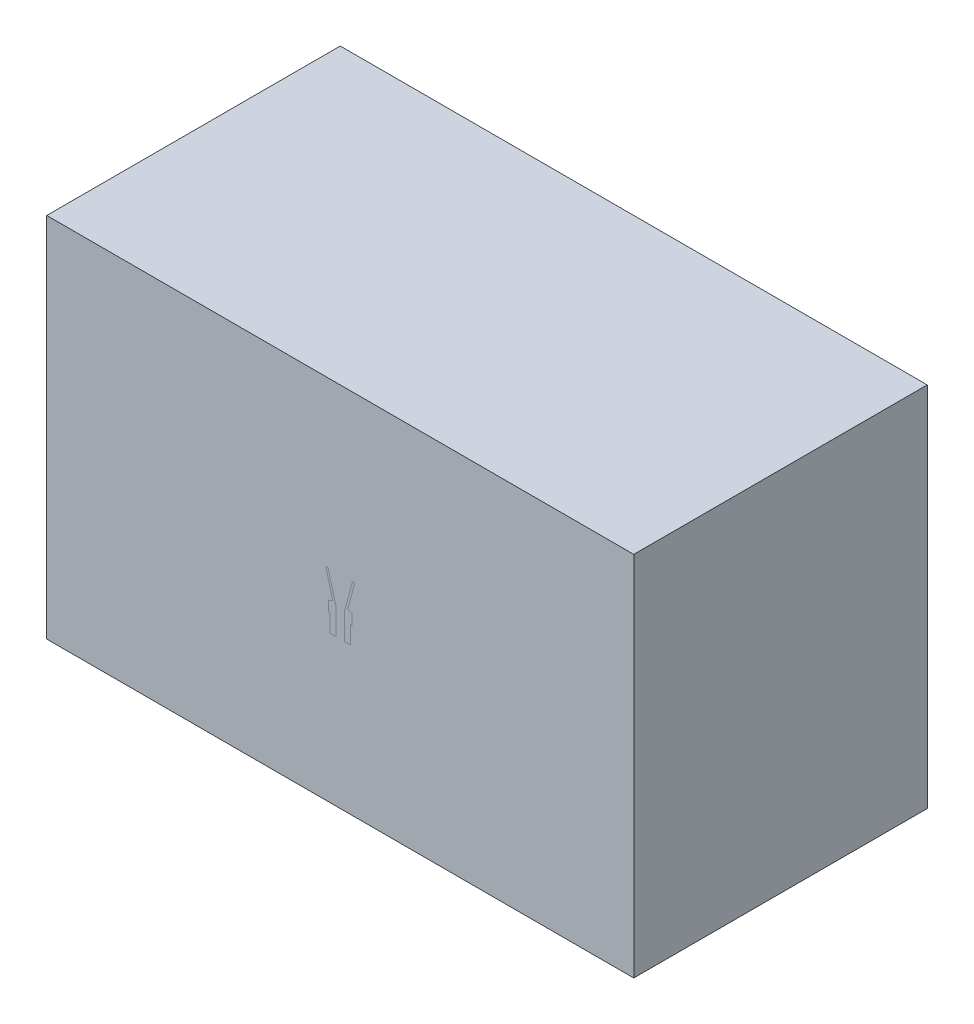
from build123d import *

# Parameters (mm, degrees)
SKETCH1_R           = 175
SKETCH1_R_2         = 75
BOSS_EXTRUDE1_DEPTH = 457
SKETCH3_W           = 10160
SKETCH3_H           = 6350
BOSS_EXTRUDE2_DEPTH = 5080
SKETCH4_W           = 13475.768327993
SKETCH4_H           = 8367.586519284
CUT_EXTRUDE1_DEPTH  = 8132.96778154


# Read off the part's stored shape, not the designer's step: Intersect1
with BuildPart() as part:
    # Sketch1 → Boss-Extrude1 (new body)
    with BuildSketch(Plane(origin=(0, 0, 0), x_dir=(1, 0, 0), z_dir=(0, 1, 0))):
        with Locations(Location((0, 0, 0), (0, 0, 270))):
            Circle(SKETCH1_R)
        with Locations(Location((0, 0, 0), (0, 0, 270))):
            Circle(SKETCH1_R_2, mode=Mode.SUBTRACT)
    extrude(amount=BOSS_EXTRUDE1_DEPTH)

    # Sketch2 → Revolve1 (revolve)
    with BuildSketch(Plane.XY, mode=Mode.PRIVATE) as revolve1_sk:
        Polygon((-175, 307), (-200.4, 307), (-200.4, 482.4), (-130.041054294, 515.208915202), (-249.855852639, 962.363830124), (-213.054078658, 972.224835743), (-94.722011237, 530.603547963), (-75, 457), (-175, 457), align=None)
    revolve(revolve1_sk.sketch.rotate(Axis((0, 0, 0), (0, 1, 0)), 270), axis=Axis((0, 0, 0), (0, 1, 0)))


with BuildPart() as body_2:
    # Sketch3 → Boss-Extrude2 (new, symmetric)
    with BuildSketch(Plane(origin=(0, 0, 0), x_dir=(0, 0, -1), z_dir=(1, 0, 0))):
        with Locations((0, 635)):
            Rectangle(SKETCH3_W, SKETCH3_H)
    extrude(amount=BOSS_EXTRUDE2_DEPTH, both=True)

    # Intersect1 outline → Intersect1 (revolve, cut)
    with BuildSketch(Plane.XY):
        Polygon((75, 457), (75, 0), (175, 0), (175, 307), (200.4, 307), (200.4, 482.4), (130.041054294, 515.208915202), (249.855852639, 962.363830124), (213.054078658, 972.224835743), align=None)
    revolve(axis=Axis((0, 0, 0), (0, 1, 0)), mode=Mode.SUBTRACT)


with BuildPart() as cut_extrude1_tool:
    # Sketch4 → Cut-Extrude1 (new, through all)
    with BuildSketch(Plane.XY):
        with Locations((454.179344916, 464.014834855)):
            Rectangle(SKETCH4_W, SKETCH4_H)
    extrude(amount=CUT_EXTRUDE1_DEPTH)


with BuildPart() as part_1:
    add(part.part)

    # Cut-Extrude1: cut by cut_extrude1_tool
    add(cut_extrude1_tool.part, mode=Mode.SUBTRACT)


with BuildPart() as body_2_1:
    add(body_2.part)

    # Cut-Extrude1: cut by cut_extrude1_tool
    add(cut_extrude1_tool.part, mode=Mode.SUBTRACT)


solid = Compound([part_1.part, body_2_1.part])
